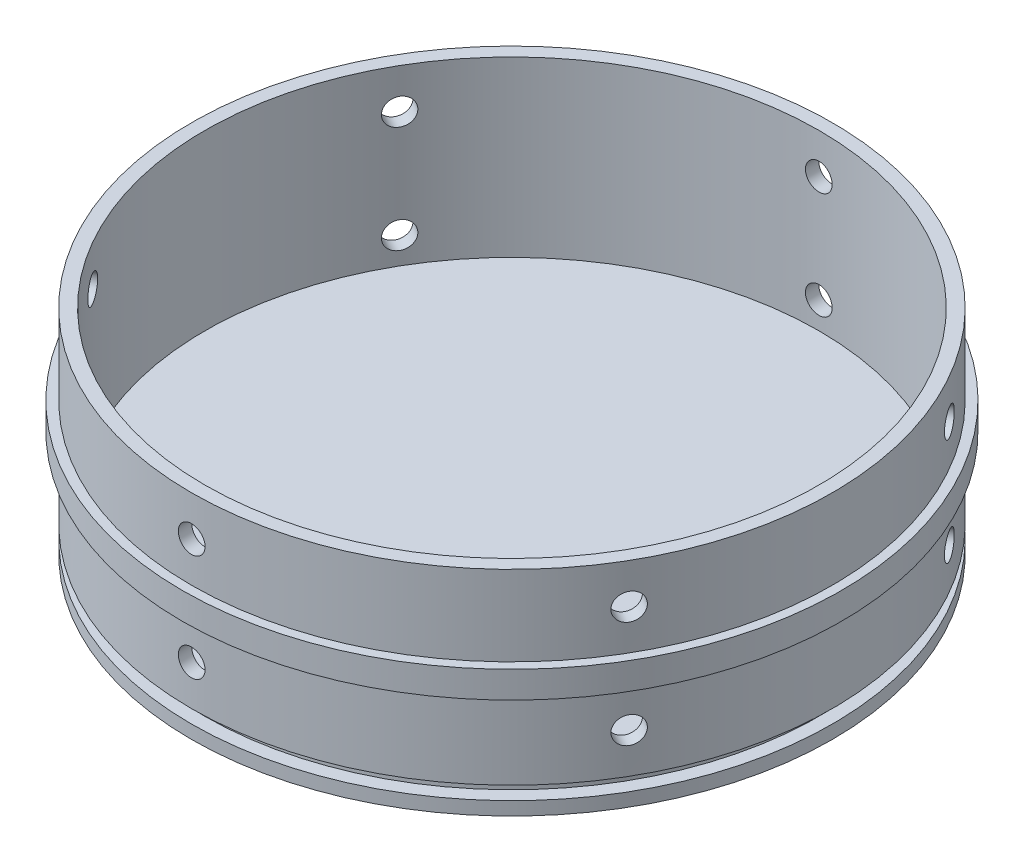
from build123d import *

# Parameters (mm, degrees)
SKETCH1_R           = 78.359
SKETCH1_R_2         = 76.2
BOSS_EXTRUDE1_DEPTH = 6.35
SKETCH1_3_R         = 76.2
SKETCH1_3_R_2       = 73.025
BOSS_EXTRUDE2_DEPTH = 25.4
BOSS_EXTRUDE3_START = 25.4
SKETCH2_R           = 76.2
SKETCH2_R_2         = 73.025
BOSS_EXTRUDE3_DEPTH = 25.4
SKETCH3_R           = 76.2
BOSS_EXTRUDE4_DEPTH = 9.525
SKETCH5_W           = 3.175
SKETCH5_H           = 3.175
SKETCH6_R           = 3.175
CUT_EXTRUDE1_DEPTH  = 12.7
CIRPATTERN1_COUNT   = 6


with BuildPart() as part:
    # Sketch1 → Boss-Extrude1 (new body)
    with BuildSketch(Plane(origin=(0, 0, 0), x_dir=(1, 0, 0), z_dir=(0, 1, 0))):
        Circle(SKETCH1_R)
        Circle(SKETCH1_R_2, mode=Mode.SUBTRACT)
    extrude(amount=BOSS_EXTRUDE1_DEPTH)

    # Sketch1<3> → Boss-Extrude2 (add)
    with BuildSketch(Plane(origin=(0, 0, 0), x_dir=(1, 0, 0), z_dir=(0, 1, 0))):
        Circle(SKETCH1_3_R)
        Circle(SKETCH1_3_R_2, mode=Mode.SUBTRACT)
    extrude(amount=BOSS_EXTRUDE2_DEPTH)

    # Sketch2 → Boss-Extrude3 (add)
    with BuildSketch(Plane.XZ.offset(BOSS_EXTRUDE3_START)):
        Circle(SKETCH2_R)
        Circle(SKETCH2_R_2, mode=Mode.SUBTRACT)
    extrude(amount=-BOSS_EXTRUDE3_DEPTH)

    # Sketch3 → Boss-Extrude4 (add)
    with BuildSketch(Plane.XZ.offset(25.4)):
        Circle(SKETCH3_R)
    extrude(amount=-BOSS_EXTRUDE4_DEPTH)

    # Sketch5 → Cut-Revolve1 (revolve, cut)
    with BuildSketch(Plane.XY):
        with Locations((-74.6125, -20.6375)):
            Rectangle(SKETCH5_W, SKETCH5_H)
    revolve(axis=Axis((0, 0, 0), (0, -1, 0)), mode=Mode.SUBTRACT)

    # Sketch6 → Cut-Extrude1 (cut)
    with BuildSketch(Plane.XY.offset(76.2)):
        with Locations((0, 15.875)):
            Circle(SKETCH6_R)
        with Locations((0, -9.525)):
            Circle(SKETCH6_R)
    cut_extrude1 = extrude(amount=-CUT_EXTRUDE1_DEPTH, mode=Mode.SUBTRACT)

    # CirPattern1: Cut-Extrude1 ×6 about axis
    cirpattern1_axis = Axis((0, 25.4, 0), (0, -1, 0))
    for i in range(1, CIRPATTERN1_COUNT):
        add(cut_extrude1.rotate(cirpattern1_axis, i * 360 / CIRPATTERN1_COUNT), mode=Mode.SUBTRACT)


solid = part.part
